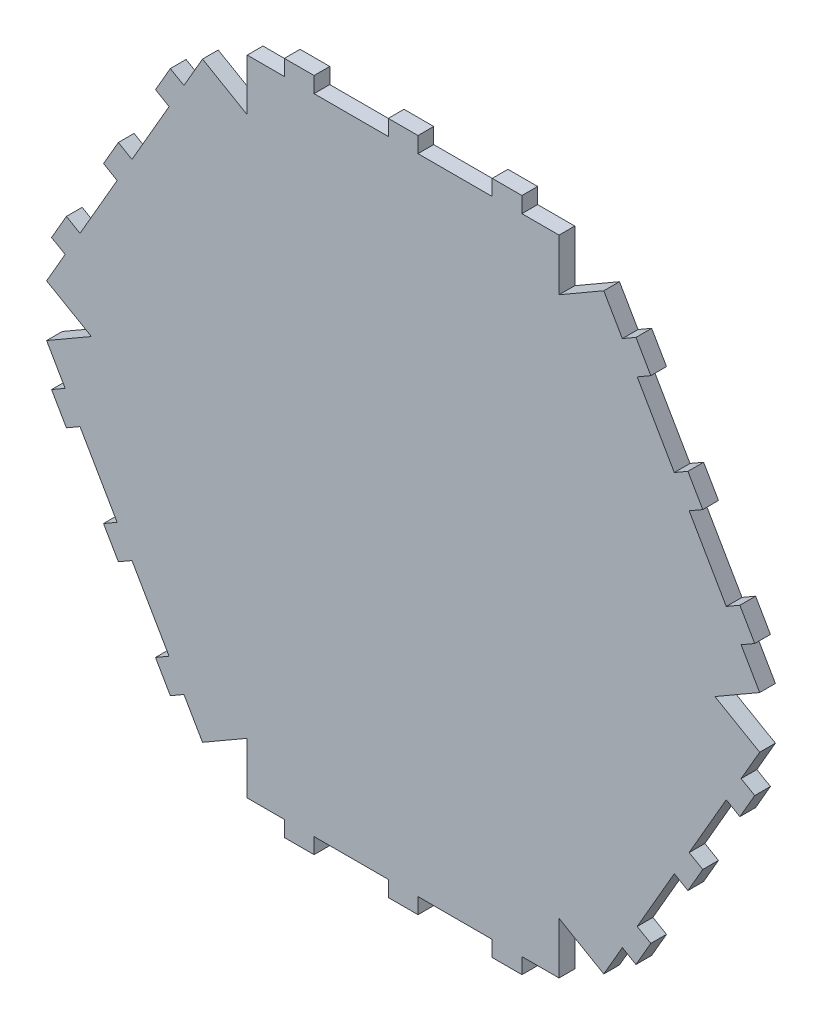
from build123d import *

# Parameters (mm, degrees)
BOSS_EXTRUDE1_DEPTH = 1.5875


with BuildPart() as part:
    # Sketch2 → Boss-Extrude1 (new, symmetric)
    with BuildSketch(Plane.XY):
        Polygon((-24, 65), (-31.5, 65), (-31.5, 54.559600438), (-40.541651246, 59.779800219), (-44.291651246, 53.284609691), (-47.041281903, 54.872109691), (-50.041281903, 49.675957268), (-47.291651246, 48.088457268), (-54.791651246, 35.098076211), (-57.541281903, 36.685576211), (-60.541281903, 31.489423789), (-57.791651246, 29.901923789), (-65.291651246, 16.911542732), (-68.041281903, 18.499042732), (-71.041281903, 13.302890309), (-68.291651246, 11.715390309), (-72.041651246, 5.220199781), (-63, 0), (-72.041651246, -5.220199781), (-68.291651246, -11.715390309), (-71.041281903, -13.302890309), (-68.041281903, -18.499042732), (-65.291651246, -16.911542732), (-57.791651246, -29.901923789), (-60.541281903, -31.489423789), (-57.541281903, -36.685576211), (-54.791651246, -35.098076211), (-47.291651246, -48.088457268), (-50.041281903, -49.675957268), (-47.041281903, -54.872109691), (-44.291651246, -53.284609691), (-40.541651246, -59.779800219), (-31.5, -54.559600438), (-31.5, -65), (-24, -65), (-24, -68.175), (-18, -68.175), (-18, -65), (-3, -65), (-3, -68.175), (3, -68.175), (3, -65), (18, -65), (18, -68.175), (24, -68.175), (24, -65), (31.5, -65), (31.5, -54.559600438), (40.541651246, -59.779800219), (44.291651246, -53.284609691), (47.041281903, -54.872109691), (50.041281903, -49.675957268), (47.291651246, -48.088457268), (54.791651246, -35.098076211), (57.541281903, -36.685576211), (60.541281903, -31.489423789), (57.791651246, -29.901923789), (65.291651246, -16.911542732), (68.041281903, -18.499042732), (71.041281903, -13.302890309), (68.291651246, -11.715390309), (72.041651246, -5.220199781), (63, 0), (72.041651246, 5.220199781), (68.291651246, 11.715390309), (71.041281903, 13.302890309), (68.041281903, 18.499042732), (65.291651246, 16.911542732), (57.791651246, 29.901923789), (60.541281903, 31.489423789), (57.541281903, 36.685576211), (54.791651246, 35.098076211), (47.291651246, 48.088457268), (50.041281903, 49.675957268), (47.041281903, 54.872109691), (44.291651246, 53.284609691), (40.541651246, 59.779800219), (31.5, 54.559600438), (31.5, 65), (24, 65), (24, 68.175), (18, 68.175), (18, 65), (3, 65), (3, 68.175), (-3, 68.175), (-3, 65), (-18, 65), (-18, 68.175), (-24, 68.175), align=None)
    extrude(amount=BOSS_EXTRUDE1_DEPTH, both=True)


solid = part.part
